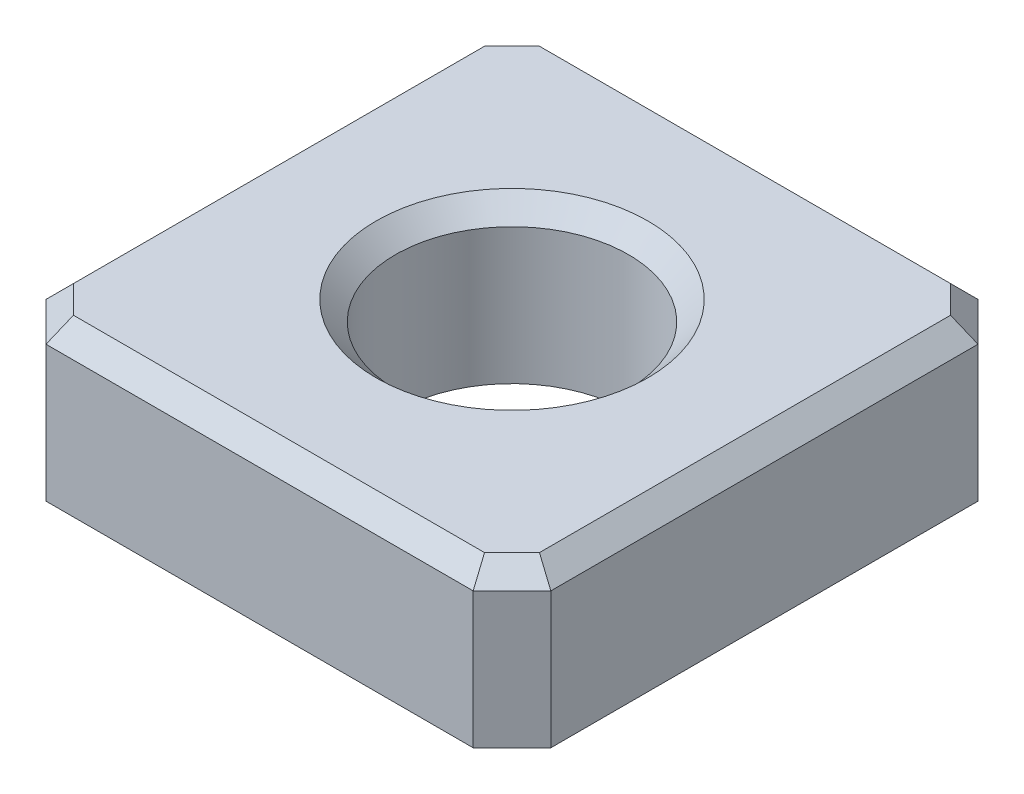
from build123d import *

# Parameters (mm, degrees)
SKETCH1_W           = 13
SKETCH1_H           = 13
SKETCH1_R           = 3
BOSS_EXTRUDE1_DEPTH = 4
CHAMFER1_SIZE       = 1
CHAMFER3_SIZE       = 0.5


with BuildPart() as part:
    # Sketch1 → Boss-Extrude1 (new body)
    with BuildSketch(Plane(origin=(0, 0, 0), x_dir=(1, 0, 0), z_dir=(0, 1, 0))):
        Rectangle(SKETCH1_W, SKETCH1_H)
        Circle(SKETCH1_R, mode=Mode.SUBTRACT)
    extrude(amount=BOSS_EXTRUDE1_DEPTH)

    # Chamfer1
    chamfer1_edges = [part.edges().sort_by_distance(p)[0] for p in [
        (-6.5, 2, -6.5),
        (-6.5, 2, 6.5),
        (6.5, 2, -6.5),
        (6.5, 2, 6.5),
    ]]
    chamfer(chamfer1_edges, length=CHAMFER1_SIZE)

    # Chamfer3
    chamfer3_edges = [part.edges().sort_by_distance(p)[0] for p in [
        (-3, 4, 0),
        (6, 4, -6),
        (6.5, 4, 0),
        (6, 4, 6),
        (0, 4, 6.5),
        (-6, 4, 6),
        (-6.5, 4, 0),
        (-6, 4, -6),
        (0, 4, -6.5),
    ]]
    chamfer(chamfer3_edges, length=CHAMFER3_SIZE)


solid = part.part
